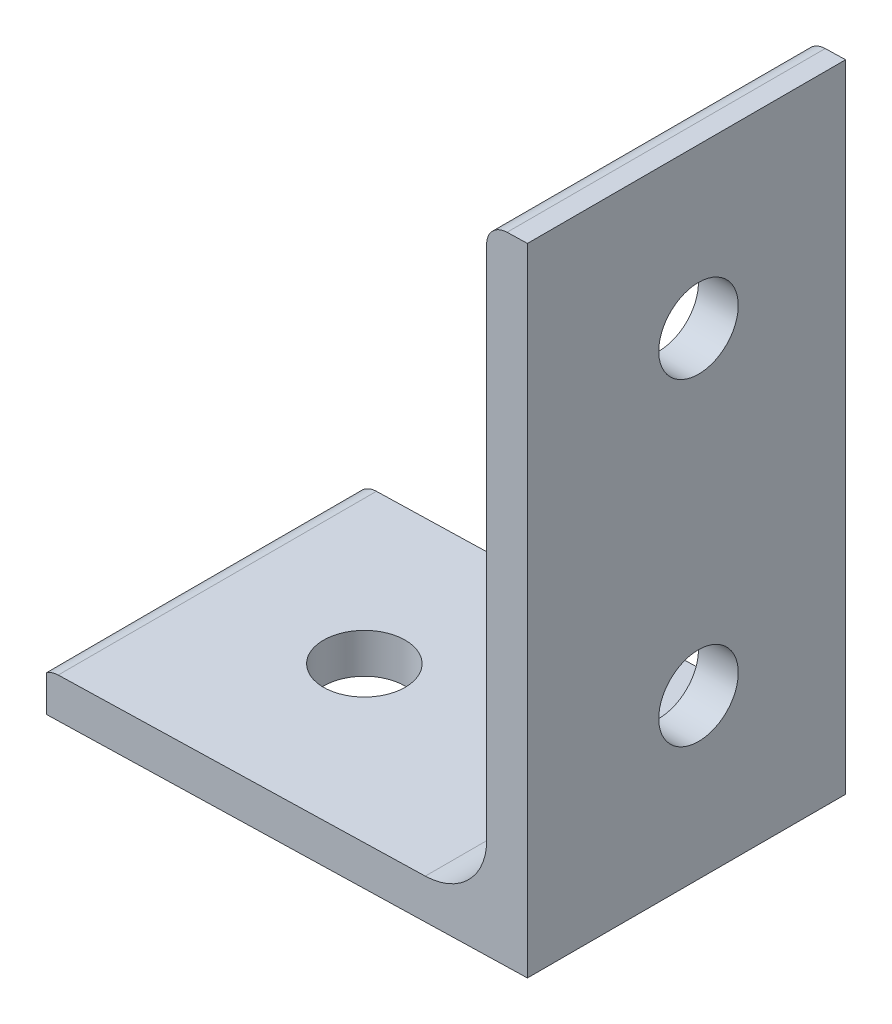
from build123d import *

# Parameters (mm, degrees)
BOSS_EXTRUDE1_DEPTH     = 15.875
SKETCH4_R               = 3.175
CUT_EXTRUDE1_DEPTH      = 49.464271634
SKETCH3_OUTSIDE_W       = 54.3
SKETCH3_OUTSIDE_H       = 47.95
CUT_EXTRUDE2_DEPTH      = 57.529267862
F_1_4_CLEARANCE_HOLE1_D = 6.5278


with BuildPart() as part:
    # Sketch2 → Boss-Extrude1 (new, symmetric)
    with BuildSketch(Plane.XY):
        with BuildLine():
            Line((-19.05, -25.4), (19.05, -25.4))
            Line((19.05, -25.4), (19.05, 25.4))
            Line((19.05, 25.4), (17.4625, 25.4))
            ThreePointArc((17.4625, 25.4), (16.339967985, 24.935032015), (15.875, 23.8125))
            Line((15.875, 23.8125), (15.875, -17.4498))
            ThreePointArc((15.875, -17.4498), (14.476376302, -20.826376302), (11.0998, -22.225))
            Line((11.0998, -22.225), (-17.4625, -22.225))
            ThreePointArc((-17.4625, -22.225), (-18.585032015, -22.689967985), (-19.05, -23.8125))
            Line((-19.05, -23.8125), (-19.05, -25.4))
        make_face()
    extrude(amount=BOSS_EXTRUDE1_DEPTH, both=True)

    # Sketch4 → Cut-Extrude1 (cut, through all)
    with BuildSketch(Plane(origin=(19.05, 0, 0), x_dir=(0, 0, -1), z_dir=(1, 0, 0))):
        with Locations((3.175, 12.7)):
            Circle(SKETCH4_R)
        with Locations((3.175, -12.7)):
            Circle(SKETCH4_R)
    extrude(amount=-CUT_EXTRUDE1_DEPTH, mode=Mode.SUBTRACT)

    # Sketch3 outside → Cut-Extrude2 (cut, through all)
    with BuildSketch(Plane.XZ.offset(25.4)):
        Rectangle(SKETCH3_OUTSIDE_W, SKETCH3_OUTSIDE_H)
        Polygon((-19.05, -13.926834826), (19.05, -14.924518438), (19.05, 10.484188491), (-18.385105513, 11.464461228), align=None, mode=Mode.SUBTRACT)
    extrude(amount=-CUT_EXTRUDE2_DEPTH, mode=Mode.SUBTRACT)

    # 1/4 Clearance Hole1 (through all)
    with Locations(Plane(origin=(0, -25.4, 0), x_dir=(-1, 0, 0), z_dir=(0, -1, 0))):
        with Locations((6.021904729, 1.563634042)):
            Hole(F_1_4_CLEARANCE_HOLE1_D / 2)


solid = part.part
